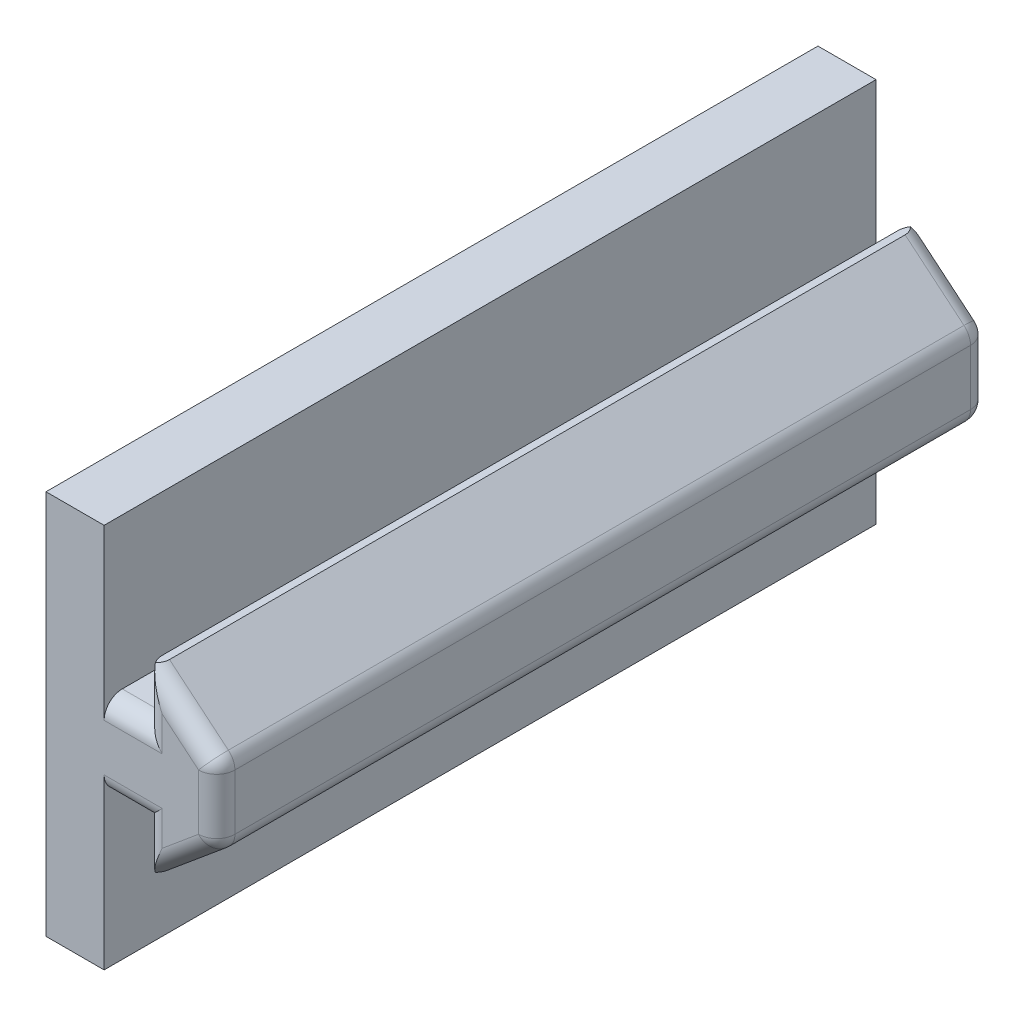
from build123d import *

# Parameters (mm, degrees)
BOSS_EXTRUDE1_DEPTH = 53.975
SKETCH2_W           = 6.858
SKETCH2_H           = 3.429
CUT_EXTRUDE1_DEPTH  = 55.91468839
SKETCH4_W           = 6.858
SKETCH4_H           = 3.429
CUT_EXTRUDE2_DEPTH  = 55.91468839
SKETCH18_W          = 53.975
SKETCH18_H          = 26.924
BOSS_EXTRUDE5_DEPTH = 4.064
FILLET1_R           = 1.27
FILLET3_R           = 1.27
FILLET5_R           = 1.27


with BuildPart() as part:
    # Sketch1 → Boss-Extrude1 (new body)
    with BuildSketch(Plane.XY.offset(26.9875)):
        Polygon((3.302, 6.35), (-4.064, 6.35), (-4.064, -6.35), (3.302, -6.35), (7.874, -2.54), (7.874, 2.54), align=None)
    extrude(amount=-BOSS_EXTRUDE1_DEPTH)

    # Sketch2 → Cut-Extrude1 (cut, through all)
    with BuildSketch(Plane.XY.offset(26.9875)):
        with Locations((-0.635, 4.6355)):
            Rectangle(SKETCH2_W, SKETCH2_H)
    extrude(amount=-CUT_EXTRUDE1_DEPTH, mode=Mode.SUBTRACT)

    # Sketch4 → Cut-Extrude2 (cut, through all)
    with BuildSketch(Plane.XY.offset(26.9875)):
        with Locations((-0.635, -4.6355)):
            Rectangle(SKETCH4_W, SKETCH4_H)
    extrude(amount=-CUT_EXTRUDE2_DEPTH, mode=Mode.SUBTRACT)

    # Sketch18 → Boss-Extrude5 (add)
    with BuildSketch(Plane.ZY.offset(4.064)):
        Rectangle(SKETCH18_W, SKETCH18_H)
    extrude(amount=-BOSS_EXTRUDE5_DEPTH)

    # Fillet1
    fillet1_edges = [part.edges().sort_by_distance(p)[0] for p in [
        (7.874, 2.54, 0),
        (7.874, -2.54, 0),
    ]]
    fillet(fillet1_edges, radius=FILLET1_R)

    # Fillet3
    # the kernel refuses this fillet: 1.27 mm, written as the material it takes off along each edge
    with BuildSketch(Plane(origin=(0.862897437, -8.382585469, -26.9875), x_dir=(-0.6401843996644798, 0.7682212795973759, 0), z_dir=(0.7682212795973759, 0.6401843996644799, 0))) as fillet3_piece_1:
        with BuildLine():
            CenterArc((FILLET3_R, FILLET3_R), FILLET3_R, 180, 90)
            Line((0, FILLET3_R), (0, 0))
            Line((0, 0), (FILLET3_R, 0))
        make_face()
    extrude(amount=8.531574072, mode=Mode.SUBTRACT)
    with BuildSketch(Plane(origin=(6.604, -1.945163819, -26.9875), x_dir=(1, 0, 0), z_dir=(0, 1, 0))) as fillet3_piece_2:
        with BuildLine():
            CenterArc((1.27 - FILLET3_R, -FILLET3_R), FILLET3_R, 0, 90)
            Line((1.27, -FILLET3_R), (1.27, 0))
            Line((1.27, 0), (1.27 - FILLET3_R, 0))
        make_face()
    revolve(axis=Axis((6.604, -1.945163819, -26.9875), (0, 0, -1)), revolution_arc=50.194428908, mode=Mode.SUBTRACT)
    with BuildSketch(Plane(origin=(7.417034188, 2.920804844, -26.9875), x_dir=(0, 0, 1), z_dir=(-0.7682212795973759, 0.6401843996644799, 0))) as fillet3_piece_3:
        with BuildLine():
            CenterArc((FILLET3_R, -FILLET3_R), FILLET3_R, 90, 90)
            Line((0, -FILLET3_R), (0, 0))
            Line((0, 0), (FILLET3_R, 0))
        make_face()
    extrude(amount=8.531574072, mode=Mode.SUBTRACT)
    with BuildSketch(Plane(origin=(6.604, 1.945163819, -26.9875), x_dir=(0.6401843996644799, 0.7682212795973757, 0), z_dir=(-0.7682212795973757, 0.6401843996644799, 0))) as fillet3_piece_4:
        with BuildLine():
            CenterArc((1.27 - FILLET3_R, -FILLET3_R), FILLET3_R, 0, 90)
            Line((1.27 - FILLET3_R, 0), (1.27, 0))
            Line((1.27, 0), (1.27, -FILLET3_R))
        make_face()
    revolve(axis=Axis((6.604, 1.945163819, -26.9875), (0, 0, -1)), revolution_arc=50.194428908, mode=Mode.SUBTRACT)
    with BuildSketch(Plane(origin=(2.794, -2.921, -26.9875), x_dir=(0, 1, 0), z_dir=(-1, 0, 0)), Plane(origin=(0, 2.921, -26.9875), x_dir=(0, -1, 0), z_dir=(1, 0, 0))) as fillet3_piece_5:
        with BuildLine():
            CenterArc((FILLET3_R, -FILLET3_R), FILLET3_R, 90, 90)
            Line((0, -FILLET3_R), (0, 0))
            Line((0, 0), (FILLET3_R, 0))
        make_face()
    extrude(amount=2.794, mode=Mode.SUBTRACT)
    with BuildSketch(Plane(origin=(2.794, 2.921, -26.9875), x_dir=(1, 0, 0), z_dir=(0, 1, 0)), Plane(origin=(2.794, -9.525, -26.9875), x_dir=(1, 0, 0), z_dir=(0, 1, 0))) as fillet3_piece_6:
        with BuildLine():
            CenterArc((FILLET3_R, -FILLET3_R), FILLET3_R, 90, 90)
            Line((0, -FILLET3_R), (0, 0))
            Line((0, 0), (FILLET3_R, 0))
        make_face()
    extrude(amount=6.604, mode=Mode.SUBTRACT)
    with BuildSketch(Plane(origin=(7.874, -1.945163819, -26.9875), x_dir=(-1, 0, 0), z_dir=(0, 1, 0))) as fillet3_piece_7:
        with BuildLine():
            CenterArc((FILLET3_R, FILLET3_R), FILLET3_R, 180, 90)
            Line((0, FILLET3_R), (0, 0))
            Line((0, 0), (FILLET3_R, 0))
        make_face()
    extrude(amount=3.890327637, mode=Mode.SUBTRACT)
    with BuildSketch(Plane(origin=(2.794, -9.525, -26.9875), x_dir=(1, 0, 0), z_dir=(0, 1, 0))) as fillet3_piece_8a_section:
        with BuildLine():
            CenterArc((FILLET3_R, -FILLET3_R), FILLET3_R, 90, 90)
            Line((0, -FILLET3_R), (0, 0))
            Line((0, 0), (FILLET3_R, 0))
        make_face()
    fillet3_piece_8a = extrude(amount=9.779, mode=Mode.PRIVATE)
    fillet3_piece_8a = split(fillet3_piece_8a, bisect_by=Plane(origin=(3.081521795, -2.921, -26.699978205), z_dir=(0, 1, 0)), keep=Keep.TOP, mode=Mode.PRIVATE)
    with BuildSketch(Plane(origin=(5.969, -2.921, -26.9875), x_dir=(0, 1, 0), z_dir=(-1, 0, 0))) as fillet3_piece_8b_section:
        with BuildLine():
            CenterArc((FILLET3_R, -FILLET3_R), FILLET3_R, 90, 90)
            Line((0, -FILLET3_R), (0, 0))
            Line((0, 0), (FILLET3_R, 0))
        make_face()
    fillet3_piece_8b = extrude(amount=5.969, mode=Mode.PRIVATE)
    fillet3_piece_8b = split(fillet3_piece_8b, bisect_by=Plane(origin=(2.794, -2.633478205, -26.699978205), z_dir=(1, 0, 0)), keep=Keep.TOP, mode=Mode.PRIVATE)
    fillet3_piece_8 = fillet3_piece_8a & fillet3_piece_8b
    add(fillet3_piece_8, mode=Mode.SUBTRACT)
    with BuildSketch(Plane(origin=(2.794, -0.254, -26.9875), x_dir=(1, 0, 0), z_dir=(0, 1, 0))) as fillet3_piece_9a_section:
        with BuildLine():
            CenterArc((FILLET3_R, -FILLET3_R), FILLET3_R, 90, 90)
            Line((0, -FILLET3_R), (0, 0))
            Line((0, 0), (FILLET3_R, 0))
        make_face()
    fillet3_piece_9a = extrude(amount=9.779, mode=Mode.PRIVATE)
    fillet3_piece_9a = split(fillet3_piece_9a, bisect_by=Plane(origin=(3.081521795, 2.921, -26.699978205), z_dir=(0, -1, 0)), keep=Keep.TOP, mode=Mode.PRIVATE)
    with BuildSketch(Plane(origin=(0, 2.921, -26.9875), x_dir=(0, -1, 0), z_dir=(1, 0, 0))) as fillet3_piece_9b_section:
        with BuildLine():
            CenterArc((FILLET3_R, -FILLET3_R), FILLET3_R, 90, 90)
            Line((0, -FILLET3_R), (0, 0))
            Line((0, 0), (FILLET3_R, 0))
        make_face()
    fillet3_piece_9b = extrude(amount=5.969, mode=Mode.PRIVATE)
    fillet3_piece_9b = split(fillet3_piece_9b, bisect_by=Plane(origin=(2.794, 2.633478205, -26.699978205), z_dir=(1, 0, 0)), keep=Keep.TOP, mode=Mode.PRIVATE)
    fillet3_piece_9 = fillet3_piece_9a & fillet3_piece_9b
    add(fillet3_piece_9, mode=Mode.SUBTRACT)

    # Fillet5
    # the kernel refuses this fillet: 1.27 mm, written as the material it takes off along each edge
    with BuildSketch(Plane(origin=(0.862897437, -8.382585469, 26.9875), x_dir=(0, 0, -1), z_dir=(0.7682212795973759, 0.6401843996644799, 0)), Plane(origin=(7.417034188, 2.920804844, 26.9875), x_dir=(0, 0, -1), z_dir=(-0.7682212795973759, 0.6401843996644799, 0))) as fillet5_piece_1:
        with BuildLine():
            CenterArc((FILLET5_R, FILLET5_R), FILLET5_R, 180, 90)
            Line((0, FILLET5_R), (0, 0))
            Line((0, 0), (FILLET5_R, 0))
        make_face()
    extrude(amount=8.531574072, mode=Mode.SUBTRACT)
    with BuildSketch(Plane(origin=(6.604, -1.945163819, 26.9875), x_dir=(1, 0, 0), z_dir=(0, 1, 0))) as fillet5_piece_2:
        with BuildLine():
            CenterArc((1.27 - FILLET5_R, FILLET5_R), FILLET5_R, 270, 90)
            Line((1.27 - FILLET5_R, 0), (1.27, 0))
            Line((1.27, 0), (1.27, FILLET5_R))
        make_face()
    revolve(axis=Axis((6.604, -1.945163819, 26.9875), (0, 0, -1)), revolution_arc=50.194428908, mode=Mode.SUBTRACT)
    with BuildSketch(Plane(origin=(6.604, 1.945163819, 26.9875), x_dir=(0.6401843996644799, 0.7682212795973757, 0), z_dir=(-0.7682212795973757, 0.6401843996644799, 0))) as fillet5_piece_3:
        with BuildLine():
            CenterArc((1.27 - FILLET5_R, FILLET5_R), FILLET5_R, 270, 90)
            Line((1.27 - FILLET5_R, 0), (1.27, 0))
            Line((1.27, 0), (1.27, FILLET5_R))
        make_face()
    revolve(axis=Axis((6.604, 1.945163819, 26.9875), (0, 0, -1)), revolution_arc=50.194428908, mode=Mode.SUBTRACT)
    with BuildSketch(Plane(origin=(2.794, 2.921, 26.9875), x_dir=(0, 0, -1), z_dir=(0, 1, 0)), Plane(origin=(2.794, -9.525, 26.9875), x_dir=(0, 0, -1), z_dir=(0, 1, 0))) as fillet5_piece_4:
        with BuildLine():
            CenterArc((FILLET5_R, -FILLET5_R), FILLET5_R, 90, 90)
            Line((0, -FILLET5_R), (0, 0))
            Line((0, 0), (FILLET5_R, 0))
        make_face()
    extrude(amount=6.604, mode=Mode.SUBTRACT)
    with BuildSketch(Plane(origin=(0, 2.921, 26.9875), x_dir=(0, 0, -1), z_dir=(1, 0, 0)), Plane(origin=(2.794, -2.921, 26.9875), x_dir=(0, 0, -1), z_dir=(-1, 0, 0))) as fillet5_piece_5:
        with BuildLine():
            CenterArc((FILLET5_R, -FILLET5_R), FILLET5_R, 90, 90)
            Line((0, -FILLET5_R), (0, 0))
            Line((0, 0), (FILLET5_R, 0))
        make_face()
    extrude(amount=2.794, mode=Mode.SUBTRACT)
    with BuildSketch(Plane(origin=(7.874, -1.945163819, 26.9875), x_dir=(0, 0, -1), z_dir=(0, 1, 0))) as fillet5_piece_6:
        with BuildLine():
            CenterArc((FILLET5_R, FILLET5_R), FILLET5_R, 180, 90)
            Line((0, FILLET5_R), (0, 0))
            Line((0, 0), (FILLET5_R, 0))
        make_face()
    extrude(amount=3.890327637, mode=Mode.SUBTRACT)
    with BuildSketch(Plane(origin=(0, 2.921, 26.9875), x_dir=(0, 0, -1), z_dir=(1, 0, 0))) as fillet5_piece_7a_section:
        with BuildLine():
            CenterArc((FILLET5_R, -FILLET5_R), FILLET5_R, 90, 90)
            Line((0, -FILLET5_R), (0, 0))
            Line((0, 0), (FILLET5_R, 0))
        make_face()
    fillet5_piece_7a = extrude(amount=5.969, mode=Mode.PRIVATE)
    fillet5_piece_7a = split(fillet5_piece_7a, bisect_by=Plane(origin=(2.794, 2.633478205, 26.699978205), z_dir=(1, 0, 0)), keep=Keep.TOP, mode=Mode.PRIVATE)
    with BuildSketch(Plane(origin=(2.794, -0.254, 26.9875), x_dir=(0, 0, -1), z_dir=(0, 1, 0))) as fillet5_piece_7b_section:
        with BuildLine():
            CenterArc((FILLET5_R, -FILLET5_R), FILLET5_R, 90, 90)
            Line((0, -FILLET5_R), (0, 0))
            Line((0, 0), (FILLET5_R, 0))
        make_face()
    fillet5_piece_7b = extrude(amount=9.779, mode=Mode.PRIVATE)
    fillet5_piece_7b = split(fillet5_piece_7b, bisect_by=Plane(origin=(3.081521795, 2.921, 26.699978205), z_dir=(0, -1, 0)), keep=Keep.TOP, mode=Mode.PRIVATE)
    fillet5_piece_7 = fillet5_piece_7a & fillet5_piece_7b
    add(fillet5_piece_7, mode=Mode.SUBTRACT)
    with BuildSketch(Plane(origin=(2.794, -9.525, 26.9875), x_dir=(0, 0, -1), z_dir=(0, 1, 0))) as fillet5_piece_8a_section:
        with BuildLine():
            CenterArc((FILLET5_R, -FILLET5_R), FILLET5_R, 90, 90)
            Line((0, -FILLET5_R), (0, 0))
            Line((0, 0), (FILLET5_R, 0))
        make_face()
    fillet5_piece_8a = extrude(amount=9.779, mode=Mode.PRIVATE)
    fillet5_piece_8a = split(fillet5_piece_8a, bisect_by=Plane(origin=(3.081521795, -2.921, 26.699978205), z_dir=(0, 1, 0)), keep=Keep.TOP, mode=Mode.PRIVATE)
    with BuildSketch(Plane(origin=(5.969, -2.921, 26.9875), x_dir=(0, 0, -1), z_dir=(-1, 0, 0))) as fillet5_piece_8b_section:
        with BuildLine():
            CenterArc((FILLET5_R, -FILLET5_R), FILLET5_R, 90, 90)
            Line((0, -FILLET5_R), (0, 0))
            Line((0, 0), (FILLET5_R, 0))
        make_face()
    fillet5_piece_8b = extrude(amount=5.969, mode=Mode.PRIVATE)
    fillet5_piece_8b = split(fillet5_piece_8b, bisect_by=Plane(origin=(2.794, -2.633478205, 26.699978205), z_dir=(1, 0, 0)), keep=Keep.TOP, mode=Mode.PRIVATE)
    fillet5_piece_8 = fillet5_piece_8a & fillet5_piece_8b
    add(fillet5_piece_8, mode=Mode.SUBTRACT)


solid = part.part
